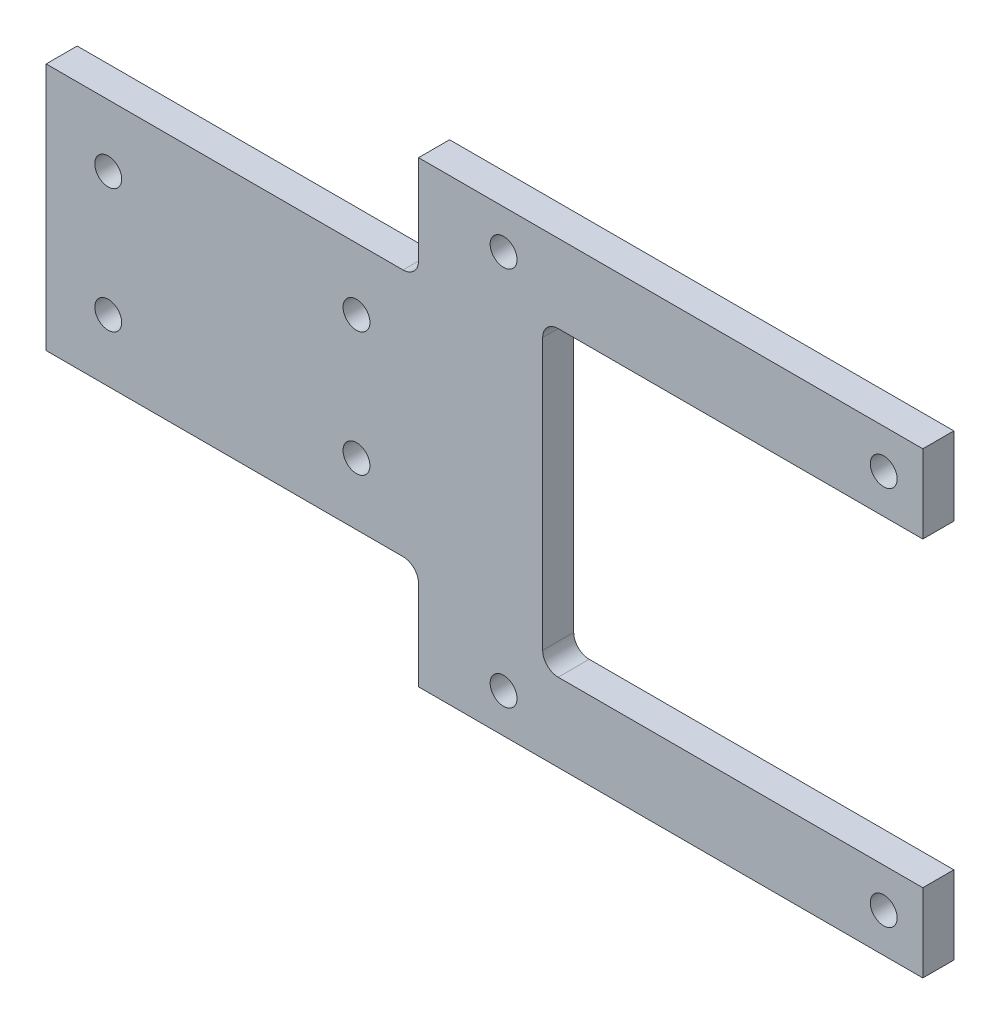
from build123d import *

# Parameters (mm, degrees)
BOSS_EXTRUDE1_DEPTH      = 6.35
M5_CLEARANCE_HOLE1_D     = 5.5
M5_CLEARANCE_HOLE1_DEPTH = 18.75
M5_CLEARANCE_HOLE1_TIP   = 1.652366702
FILLET1_R                = 3.175
M5_CLEARANCE_HOLE2_D     = 5.5
M5_CLEARANCE_HOLE2_DEPTH = 18.75
M5_CLEARANCE_HOLE2_TIP   = 1.652366702


with BuildPart() as part:
    # Sketch1 → Boss-Extrude1 (new body)
    with BuildSketch(Plane.XY):
        Polygon((38.1, 25.4), (38.1, 46.890872965), (141.281745931, 46.890872965), (141.281745931, 30.890872965), (63.5, 30.890872965), (63.5, -30.890872965), (141.281745931, -30.890872965), (141.281745931, -46.890872965), (38.1, -46.890872965), (38.1, -25.4), (-38.1, -25.4), (-38.1, 25.4), align=None)
    extrude(amount=BOSS_EXTRUDE1_DEPTH)

    # M5 Clearance Hole1
    with Locations(Plane.XY.offset(6.35)):
        with Locations((133.281745931, 38.890872965), (133.281745931, -38.890872965), (55.5, 38.890872965), (55.5, -38.890872965)):
            Hole(M5_CLEARANCE_HOLE1_D / 2, depth=M5_CLEARANCE_HOLE1_DEPTH)
            with Locations((0, 0, -(M5_CLEARANCE_HOLE1_DEPTH + M5_CLEARANCE_HOLE1_TIP / 2))):  # 118° drill point
                Cone(0, M5_CLEARANCE_HOLE1_D / 2, M5_CLEARANCE_HOLE1_TIP, mode=Mode.SUBTRACT)

    # Fillet1
    fillet1_edges = [part.edges().sort_by_distance(p)[0] for p in [
        (63.5, 30.890872965, 3.175),
        (63.5, -30.890872965, 3.175),
        (38.1, -25.4, 3.175),
        (38.1, 25.4, 3.175),
    ]]
    fillet(fillet1_edges, radius=FILLET1_R)

    # M5 Clearance Hole2
    with Locations(Plane.XY.offset(6.35)):
        with Locations((-25.4, 12.7), (25.4, 12.7), (25.4, -12.7), (-25.4, -12.7)):
            Hole(M5_CLEARANCE_HOLE2_D / 2, depth=M5_CLEARANCE_HOLE2_DEPTH)
            with Locations((0, 0, -(M5_CLEARANCE_HOLE2_DEPTH + M5_CLEARANCE_HOLE2_TIP / 2))):  # 118° drill point
                Cone(0, M5_CLEARANCE_HOLE2_D / 2, M5_CLEARANCE_HOLE2_TIP, mode=Mode.SUBTRACT)


solid = part.part
